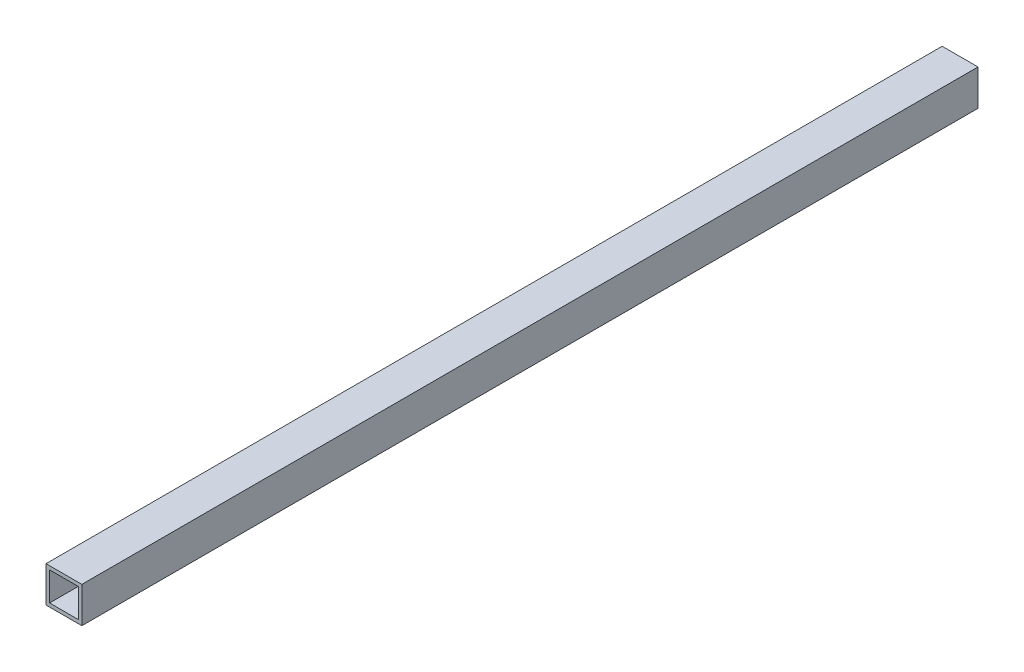
from build123d import *

# Parameters (mm, degrees)
SKETCH_1_W      = 10
SKETCH_1_H      = 10
SKETCH_1_W_2    = 8
SKETCH_1_H_2    = 8
EXTRUDE_1_DEPTH = 250


with BuildPart() as part:
    # 草图1 → 凸台-拉伸1 (new body)
    with BuildSketch(Plane.XY):
        Rectangle(SKETCH_1_W, SKETCH_1_H)
        Rectangle(SKETCH_1_W_2, SKETCH_1_H_2, mode=Mode.SUBTRACT)
    extrude(amount=EXTRUDE_1_DEPTH)


solid = part.part
